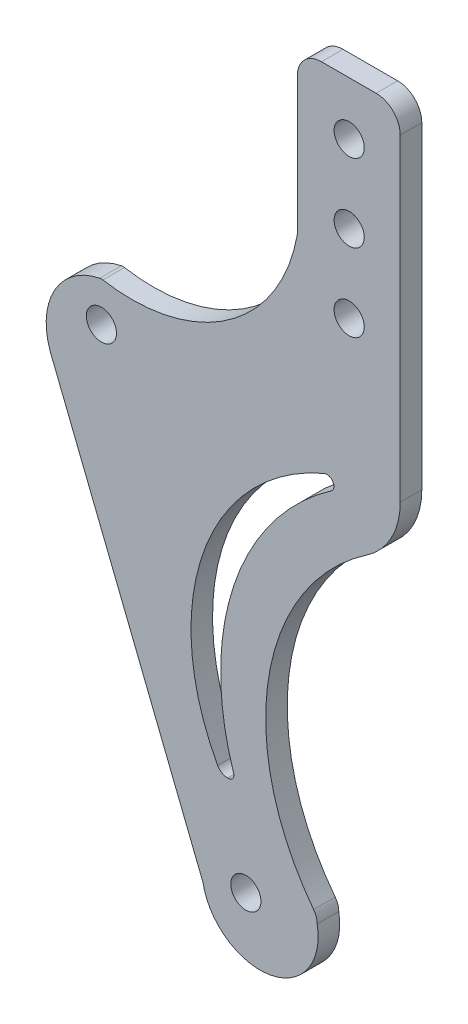
from build123d import *

# Parameters (mm, degrees)
SKETCH1_R           = 2.2225
BOSS_EXTRUDE1_DEPTH = 3.175
CUT_EXTRUDE3_DEPTH  = 111.684893933


with BuildPart() as part:
    # Sketch1 → Boss-Extrude1 (new body)
    with BuildSketch(Plane.XY):
        with BuildLine():
            Line((-26.682968963, 26.357722587), (-26.682968963, 6.351785872))
            ThreePointArc((-26.682968963, 6.351785872), (-26.693527307, 6.120431356), (-26.725114563, 5.891000243))
            ThreePointArc((-26.725114563, 5.891000243), (-36.932915208, -9.945248539), (-55.328203965, -14.019474973))
            ThreePointArc((-55.328203965, -14.019474973), (-55.554473877, -14.001365453), (-55.780223055, -14.025100158))
            ThreePointArc((-55.780223055, -14.025100158), (-62.402560981, -18.816713415), (-63.103372405, -26.960654757))
            Line((-63.103372405, -26.960654757), (-40.595944625, -83.455943866))
            ThreePointArc((-40.595944625, -83.455943866), (-30.641352377, -90.339421853), (-23.75787439, -80.384829605))
            ThreePointArc((-23.75787439, -80.384829605), (-23.88583974, -79.549342433), (-24.280867854, -78.802103023))
            ThreePointArc((-24.280867854, -78.802103023), (-30.912062559, -52.492603109), (-16.357010265, -29.594721511))
            ThreePointArc((-16.357010265, -29.594721511), (-12.809669567, -25.627558214), (-11.528139151, -20.46231955))
            Line((-11.528139151, -20.46231955), (-11.528139151, 26.357722587))
            ThreePointArc((-11.528139151, 26.357722587), (-12.569667438, 28.872194301), (-15.084139151, 29.913722587))
            Line((-15.084139151, 29.913722587), (-23.126968963, 29.913722587))
            ThreePointArc((-23.126968963, 29.913722587), (-25.641440677, 28.872194301), (-26.682968963, 26.357722587))
        make_face()
        with Locations((-55.544078679, -19.824964902)):
            Circle(SKETCH1_R, mode=Mode.SUBTRACT)
        with Locations((-19.05, 22.084955235)):
            Circle(SKETCH1_R, mode=Mode.SUBTRACT)
        with Locations((-19.05, -0.775044765)):
            Circle(SKETCH1_R, mode=Mode.SUBTRACT)
        with Locations((-34.268702177, -81.651111456)):
            Circle(SKETCH1_R, mode=Mode.SUBTRACT)
        with Locations((-19.05, 10.654955235)):
            Circle(SKETCH1_R, mode=Mode.SUBTRACT)
    extrude(amount=BOSS_EXTRUDE1_DEPTH)

    # Sketch2 → Cut-Extrude3 (cut, through all)
    with BuildSketch(Plane.XY.offset(3.175)):
        with BuildLine():
            Line((-36.831852109, -68.355568291), (-36.974174847, -68.355568291))
            ThreePointArc((-36.974174847, -68.355568291), (-37.814529912, -68.124830586), (-38.41923442, -67.49732044))
            ThreePointArc((-38.41923442, -67.49732044), (-40.560877305, -41.476963968), (-22.736071327, -22.400227427))
            ThreePointArc((-22.736071327, -22.400227427), (-22.049625823, -22.361915504), (-21.49725312, -22.771255986))
            Line((-21.49725312, -22.771255986), (-21.445994246, -22.848430618))
            ThreePointArc((-21.445994246, -22.848430618), (-21.310567587, -23.518602122), (-21.682052424, -24.092596233))
            ThreePointArc((-21.682052424, -24.092596233), (-36.031427567, -43.311479166), (-36.065733623, -67.296242063))
            ThreePointArc((-36.065733623, -67.296242063), (-36.178187518, -68.02161048), (-36.831852109, -68.355568291))
        make_face()
    extrude(amount=-CUT_EXTRUDE3_DEPTH, mode=Mode.SUBTRACT)


solid = part.part
